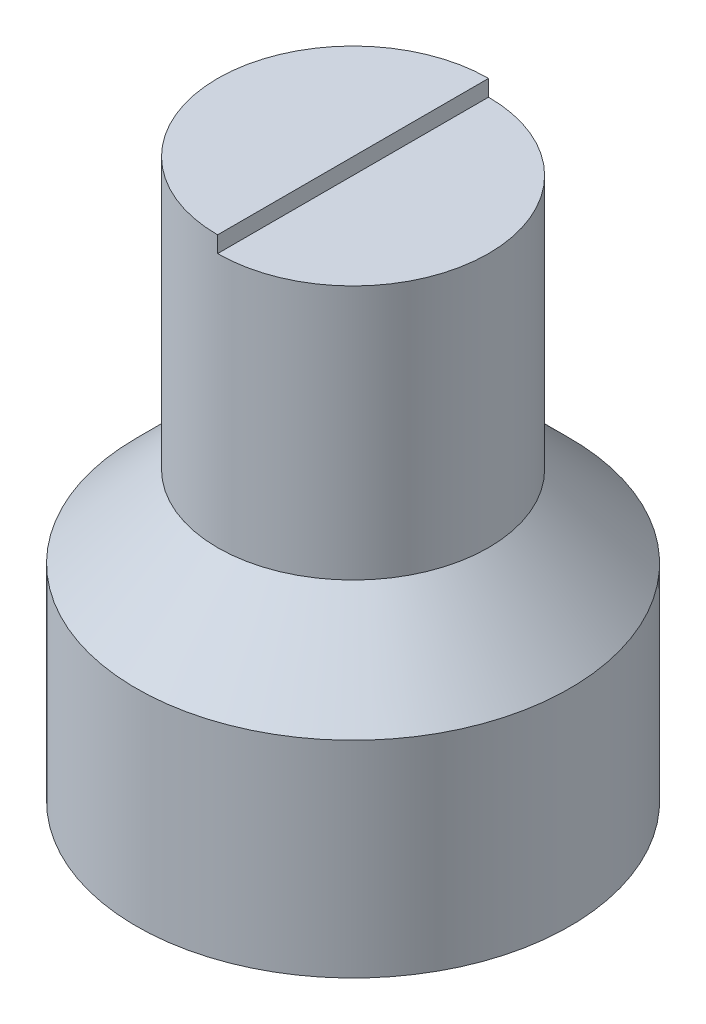
from build123d import *

# Parameters (mm, degrees)
SKETCH_4_W             = 5
SKETCH_4_H             = 10
CUT_EXTRUDE_849_DEPTH  = 0.6
CHAMFER_1_SIZE         = 3
SKETCH_5_R             = 5.1
CUT_EXTRUDE_1019_DEPTH = 5.1
HOLE_WIZARD_M3_D       = 2.5
HOLE_WIZARD_M3_DEPTH   = 10
HOLE_WIZARD_M3_TIP     = 0.751075774


with BuildPart() as part:
    # Эскиз1 → Revolve 497 (revolve)
    with BuildSketch(Plane.XY):
        Polygon((0, 10.3), (-5, 10.3), (-5, 0.3), (-8, 0.3), (-8, -10.3), (0, -10.3), align=None)
    revolve(axis=Axis((0, 10.3, 0), (0, -1, 0)))

    # Эскиз4 → Cut-Extrude 849 (cut)
    with BuildSketch(Plane(origin=(0, 10.3, 0), x_dir=(1, 0, 0), z_dir=(0, 1, 0))):
        with Locations((2.5, 0)):
            Rectangle(SKETCH_4_W, SKETCH_4_H)
    extrude(amount=-CUT_EXTRUDE_849_DEPTH, mode=Mode.SUBTRACT)

    # Фаска1
    chamfer_1_edges = [part.edges().sort_by_distance(p)[0] for p in [
        (8, 0.3, 0),
    ]]
    chamfer(chamfer_1_edges, length=CHAMFER_1_SIZE - 0.0001)  # a hair under: the kernel refuses the full size

    # Эскиз5 → Cut-Extrude 1019 (cut)
    with BuildSketch(Plane.XZ.offset(10.3)):
        Circle(SKETCH_5_R)
    extrude(amount=-CUT_EXTRUDE_1019_DEPTH, mode=Mode.SUBTRACT)

    # Крепление магнита M3
    with Locations(Plane(origin=(0, -5.2, 0), x_dir=(-1, 0, 0), z_dir=(0, -1, 0))):
        with Locations((0, 0)):
            Hole(HOLE_WIZARD_M3_D / 2, depth=HOLE_WIZARD_M3_DEPTH)
            with Locations((0, 0, -(HOLE_WIZARD_M3_DEPTH + HOLE_WIZARD_M3_TIP / 2))):  # 118° drill point
                Cone(0, HOLE_WIZARD_M3_D / 2, HOLE_WIZARD_M3_TIP, mode=Mode.SUBTRACT)


solid = part.part
